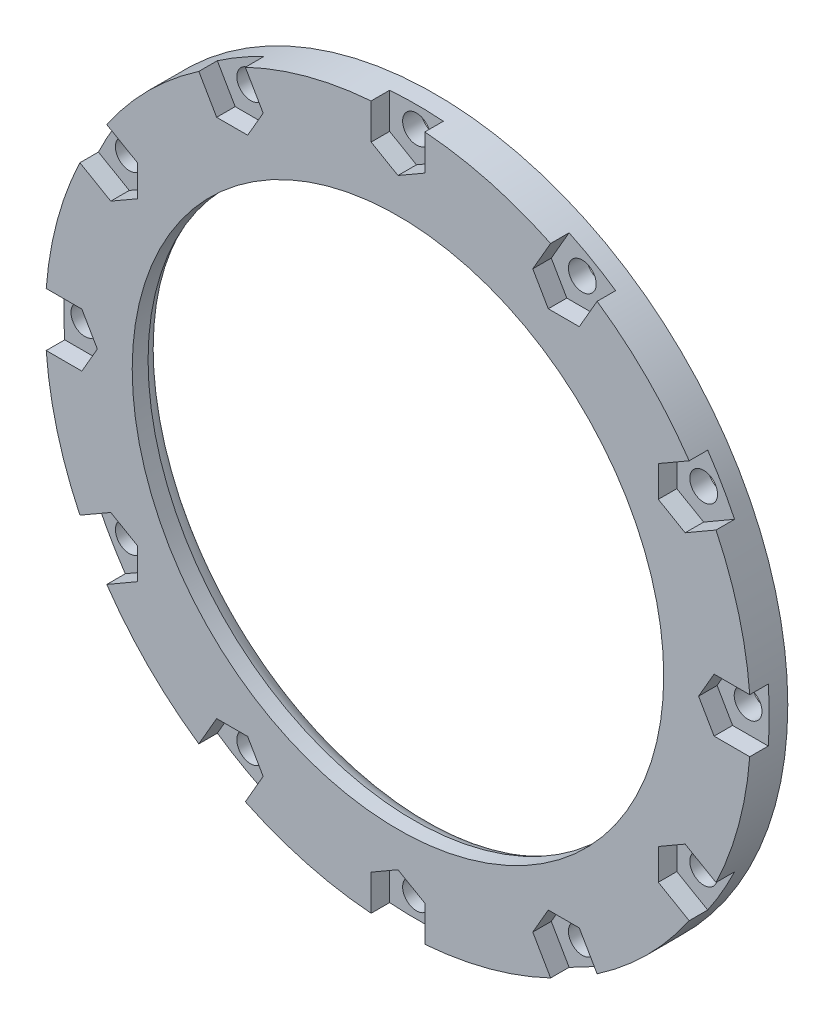
from build123d import *

# Parameters (mm, degrees)
SKETCH1_R           = 38.1
SKETCH1_R_2         = 28.702
BOSS_EXTRUDE1_DEPTH = 4
SKETCH2_R           = 1.5
CUT_EXTRUDE1_DEPTH  = 55.029806589
CUT_EXTRUDE2_DEPTH  = 2


with BuildPart() as part:
    # Sketch1 → Boss-Extrude1 (new body)
    with BuildSketch(Plane.XY):
        Circle(SKETCH1_R)
        Circle(SKETCH1_R_2, mode=Mode.SUBTRACT)
    extrude(amount=BOSS_EXTRUDE1_DEPTH)

    # Sketch2 → Cut-Extrude1 (cut, through all)
    with BuildSketch(Plane.XY.offset(4)):
        with Locations((0, 35.814)):
            Circle(SKETCH2_R)
        with Locations((17.907, 31.015833811)):
            Circle(SKETCH2_R)
        with Locations((31.015833811, 17.907)):
            Circle(SKETCH2_R)
        with Locations((35.814, 0)):
            Circle(SKETCH2_R)
        with Locations((31.015833811, -17.907)):
            Circle(SKETCH2_R)
        with Locations((17.907, -31.015833811)):
            Circle(SKETCH2_R)
        with Locations((0, -35.814)):
            Circle(SKETCH2_R)
        with Locations((-17.907, -31.015833811)):
            Circle(SKETCH2_R)
        with Locations((-31.015833811, -17.907)):
            Circle(SKETCH2_R)
        with Locations((-35.814, 0)):
            Circle(SKETCH2_R)
        with Locations((-31.015833811, 17.907)):
            Circle(SKETCH2_R)
        with Locations((-17.907, 31.015833811)):
            Circle(SKETCH2_R)
    extrude(amount=-CUT_EXTRUDE1_DEPTH, mode=Mode.SUBTRACT)

    # Sketch3 → Cut-Extrude2 (cut)
    with BuildSketch(Plane.XY.offset(4)):
        Polygon((-2.9, 37.989472226), (0, 39.162631561), (2.9, 37.989472226), (2.9, 34.139684219), (0, 32.465368439), (-2.9, 34.139684219), align=None)
        Polygon((16.483262442, 34.349848024), (19.581315781, 33.915833811), (21.506209784, 31.449848024), (19.581315781, 28.115833811), (16.232684219, 28.115833811), (14.558368439, 31.015833811), align=None)
        Polygon((31.449848024, 21.506209784), (33.915833811, 19.581315781), (34.349848024, 16.483262442), (31.015833811, 14.558368439), (28.115833811, 16.232684219), (28.115833811, 19.581315781), align=None)
        Polygon((37.989472226, 2.9), (39.162631561, 0), (37.989472226, -2.9), (34.139684219, -2.9), (32.465368439, 0), (34.139684219, 2.9), align=None)
        Polygon((34.349848024, -16.483262442), (33.915833811, -19.581315781), (31.449848024, -21.506209784), (28.115833811, -19.581315781), (28.115833811, -16.232684219), (31.015833811, -14.558368439), align=None)
        Polygon((21.506209784, -31.449848024), (19.581315781, -33.915833811), (16.483262442, -34.349848024), (14.558368439, -31.015833811), (16.232684219, -28.115833811), (19.581315781, -28.115833811), align=None)
        Polygon((2.9, -37.989472226), (0, -39.162631561), (-2.9, -37.989472226), (-2.9, -34.139684219), (0, -32.465368439), (2.9, -34.139684219), align=None)
        Polygon((-16.483262442, -34.349848024), (-19.581315781, -33.915833811), (-21.506209784, -31.449848024), (-19.581315781, -28.115833811), (-16.232684219, -28.115833811), (-14.558368439, -31.015833811), align=None)
        Polygon((-31.449848024, -21.506209784), (-33.915833811, -19.581315781), (-34.349848024, -16.483262442), (-31.015833811, -14.558368439), (-28.115833811, -16.232684219), (-28.115833811, -19.581315781), align=None)
        Polygon((-37.989472226, -2.9), (-39.162631561, 0), (-37.989472226, 2.9), (-34.139684219, 2.9), (-32.465368439, 0), (-34.139684219, -2.9), align=None)
        Polygon((-34.349848024, 16.483262442), (-33.915833811, 19.581315781), (-31.449848024, 21.506209784), (-28.115833811, 19.581315781), (-28.115833811, 16.232684219), (-31.015833811, 14.558368439), align=None)
        Polygon((-21.506209784, 31.449848024), (-19.581315781, 33.915833811), (-16.483262442, 34.349848024), (-14.558368439, 31.015833811), (-16.232684219, 28.115833811), (-19.581315781, 28.115833811), align=None)
    extrude(amount=-CUT_EXTRUDE2_DEPTH, mode=Mode.SUBTRACT)

    # Sketch4 → Cut-Revolve1 (revolve, cut)
    with BuildSketch(Plane(origin=(0, 0, 0), x_dir=(1, 0, 0), z_dir=(0, 1, 0))):
        with BuildLine():
            Line((31.75, 0), (0, 0))
            Line((0, 0), (0, -3.175))
            Line((0, -3.175), (28.575, -3.175))
            ThreePointArc((28.575, -3.175), (29.50493597, -0.92993597), (31.75, 0))
        make_face()
    revolve(axis=Axis((0, 0, 24.794567933), (0, 0, -1)), mode=Mode.SUBTRACT)


solid = part.part
